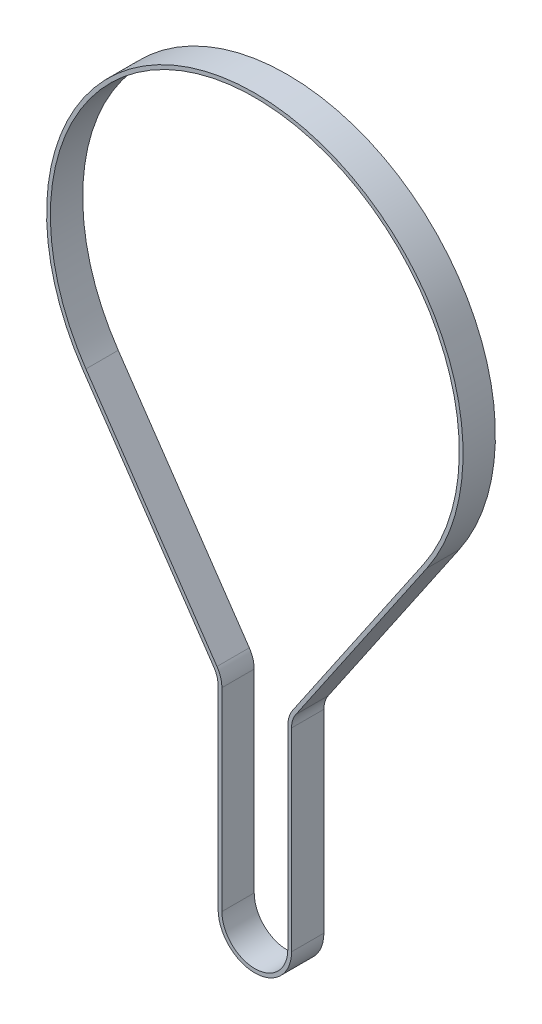
from build123d import *

# Parameters (mm, degrees)
BOSS_EXTRUDE1_DEPTH = 6


with BuildPart() as part:
    # Sketch2 → Boss-Extrude1 (new body)
    with BuildSketch(Plane.XY):
        with BuildLine():
            Line((-6.8162, 35.979312386), (-6.8162, 0))
            ThreePointArc((-6.8162, 0), (0, -6.8162), (6.8162, 0))
            Line((6.8162, 0), (6.8162, 35.979312386))
            ThreePointArc((6.8162, 35.979312386), (7.018449399, 37.320790939), (7.607217454, 38.543010929))
            Line((7.607217454, 38.543010929), (31.928384669, 74.203538686))
            ThreePointArc((31.928384669, 74.203538686), (0, 134.626512386), (-31.928384669, 74.203538686))
            Line((-31.928384669, 74.203538686), (-7.607217454, 38.543010929))
            ThreePointArc((-7.607217454, 38.543010929), (-7.018449399, 37.320790939), (-6.8162, 35.979312386))
        make_face()
        with BuildLine():
            Line((-6.1162, 35.979312386), (-6.1162, 0))
            ThreePointArc((-6.1162, 0), (0, -6.1162), (6.1162, 0))
            Line((6.1162, 0), (6.1162, 35.979312386))
            ThreePointArc((6.1162, 35.979312386), (6.349564691, 37.527172255), (7.028912447, 38.93742609))
            Line((7.028912447, 38.93742609), (31.350079662, 74.597953847))
            ThreePointArc((31.350079662, 74.597953847), (0, 133.926512386), (-31.350079662, 74.597953847))
            Line((-31.350079662, 74.597953847), (-7.028912447, 38.93742609))
            ThreePointArc((-7.028912447, 38.93742609), (-6.349564691, 37.527172255), (-6.1162, 35.979312386))
        make_face(mode=Mode.SUBTRACT)
    extrude(amount=BOSS_EXTRUDE1_DEPTH)


solid = part.part
